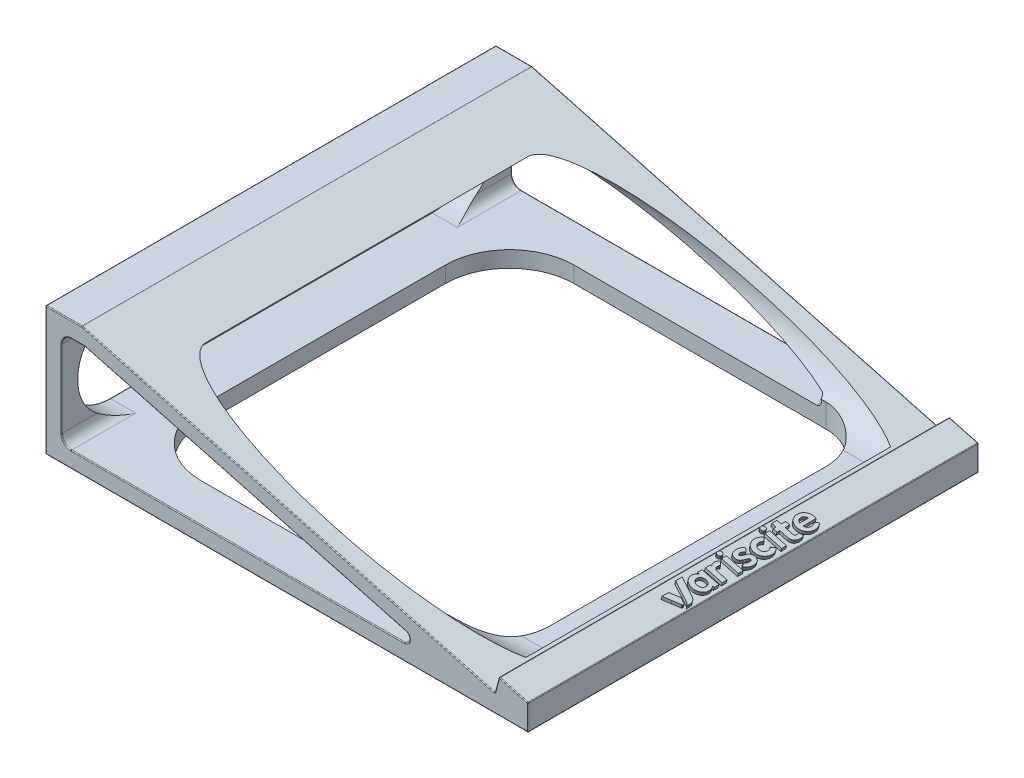
from build123d import *

# Parameters (mm, degrees)
AUFSATZ_LINEAR_AUSTRAGEN1_DEPTH = 140
SCHNITT_HINTEN_AUSTRAGEN_DEPTH  = 136
SCHNITT_BODEN_AUSTRAGEN_DEPTH   = 10
SCHNITT_SEITE_AUSTRAGEN_DEPTH   = 140
KATENVERRUNDUNG_AUSTRAGEN_R     = 0.25
LOGO_AUSTRAGEN_DEPTH            = 1


with BuildPart() as part:
    # Basis → Aufsatz-Linear austragen1 (new body)
    with BuildSketch(Plane(origin=(0, 0, 0), x_dir=(0, 1, 0), z_dir=(0, 0, 1))):
        Polygon((0, 0), (0, 150), (40, 150), (40, 138.744142368), (5.590481338, 10.326070457), (10.420110469, 9.031975232), (8, 0), align=None)
    extrude(amount=AUFSATZ_LINEAR_AUSTRAGEN1_DEPTH)

    # Schnitt Hinten → Schnitt Hinten austragen (cut)
    with BuildSketch(Plane(origin=(-150, 0, 0), x_dir=(0, -1, 0), z_dir=(-1, 0, 0))):
        with BuildLine():
            Line((-5, 120), (-5, 20))
            ThreePointArc((-5, 20), (-20, 5), (-35, 20))
            Line((-35, 20), (-35, 120))
            ThreePointArc((-35, 120), (-20, 135), (-5, 120))
        make_face()
    extrude(amount=-SCHNITT_HINTEN_AUSTRAGEN_DEPTH, mode=Mode.SUBTRACT)

    # Schnitt Boden → Schnitt Boden austragen (cut)
    with BuildSketch(Plane(origin=(0.359069892, 0, 0), x_dir=(-1, 0, 0), z_dir=(0, 1, 0))):
        with BuildLine():
            Line((35.68514035, 128), (114.10321226, 128))
            ThreePointArc((114.10321226, 128), (128.245347884, 122.142135624), (134.10321226, 108))
            Line((134.10321226, 108), (134.10321226, 32))
            ThreePointArc((134.10321226, 32), (128.245347884, 17.857864376), (114.10321226, 12))
            Line((114.10321226, 12), (35.68514035, 12))
            ThreePointArc((35.68514035, 12), (25.078538632, 16.393398282), (20.68514035, 27))
            Line((20.68514035, 27), (20.68514035, 113))
            ThreePointArc((20.68514035, 113), (25.078538632, 123.606601718), (35.68514035, 128))
        make_face()
    extrude(amount=SCHNITT_BODEN_AUSTRAGEN_DEPTH, mode=Mode.SUBTRACT)

    # Schnitt Seite → Schnitt Seite austragen (cut)
    with BuildSketch(Plane.XY.offset(140)):
        with BuildLine():
            Line((-142, 35), (-137.763461174, 35))
            Line((-137.763461174, 35), (-37.972483895, 8.261088226))
            ThreePointArc((-37.972483895, 8.261088226), (-37.170682452, 7.72534163), (-36.860712462, 6.812199487))
            Line((-36.860712462, 6.812199487), (-36.860712462, 6.5))
            ThreePointArc((-36.860712462, 6.5), (-37.300052291, 5.439339828), (-38.360712462, 5))
            Line((-38.360712462, 5), (-142, 5))
            ThreePointArc((-142, 5), (-144.121320344, 5.878679656), (-145, 8))
            Line((-145, 8), (-145, 32))
            ThreePointArc((-145, 32), (-144.121320344, 34.121320344), (-142, 35))
        make_face()
    extrude(amount=-SCHNITT_SEITE_AUSTRAGEN_DEPTH, mode=Mode.SUBTRACT)

    # Katenverrundung austragen
    katenverrundung_austragen_edges = [part.edges().sort_by_distance(p)[0] for p in [
        (-36.860712462, 6.656099743, 140),
        (0, 0, 70),
        (0, 4, 0),
        (-36.860712462, 6.656099743, 0),
        (-37.170682452, 7.72534163, 0),
        (-37.300052291, 5.439339828, 0),
        (-139.881730587, 35, 0),
        (-87.867972534, 21.630544113, 0),
        (-144.121320344, 34.121320344, 0),
        (-144.121320344, 5.878679656, 0),
        (-145, 20, 0),
        (-150, 35, 70),
        (-150, 20, 135),
        (-150, 20, 5),
        (-150, 5, 70),
        (-150, 0, 70),
        (-90.180356231, 5, 0),
        (-75, 0, 0),
        (0, 8, 70),
        (-4.515987616, 9.210055235, 0),
        (-9.679022845, 8.005295904, 0),
        (-10.326070457, 5.590481338, 70),
        (-9.031975232, 10.420110469, 70),
        (-138.744142368, 40, 70),
        (-37.300052291, 5.439339828, 140),
        (-144.121320344, 5.878679656, 140),
        (-144.121320344, 34.121320344, 140),
        (-139.881730587, 35, 140),
        (-87.867972534, 21.630544113, 140),
        (-145, 20, 140),
        (-37.170682452, 7.72534163, 140),
        (-90.180356231, 5, 140),
        (-75, 0, 140),
        (0, 4, 140),
        (-4.515987616, 9.210055235, 140),
        (-9.679022845, 8.005295904, 140),
        (-150, 20, 140),
        (-144.372071184, 40, 140),
        (-74.535106413, 22.795240669, 140),
        (-74.535106413, 22.795240669, 0),
        (-144.372071184, 40, 0),
        (-150, 20, 0),
        (-150, 40, 70),
    ]]
    fillet(katenverrundung_austragen_edges, radius=KATENVERRUNDUNG_AUSTRAGEN_R)

    # Skizze Logo → Logo austragen (add)
    # profile 1 of 12: a face of its own
    with BuildSketch(Plane(origin=(2, 7.464101615, 0), x_dir=(-0.9659258262890681, 0.25881904510252157, 0), z_dir=(0.25881904510252157, 0.9659258262890681, 0))):
        Polygon((8.765310954, 83.335963454), (8.722327205, 83.550293267), (8.6616974, 83.757364103), (8.584147923, 83.956513719), (8.49040509, 84.147079603), (8.381195148, 84.328399308), (8.257244616, 84.499810457), (8.119279742, 84.660650604), (7.968026842, 84.81025744), (7.804212233, 84.947968383), (7.628562364, 85.073121056), (7.441803485, 85.18505308), (7.244662045, 85.283102079), (7.037864227, 85.366605538), (6.82213648, 85.434901081), (6.59820512, 85.487326261), (6.366796532, 85.523218634), (6.105453465, 85.539483887), (5.809549458, 85.535778455), (5.520729813, 85.513920388), (5.280639966, 85.475727532), (5.078100426, 85.422709442), (4.883314977, 85.357432403), (4.696687144, 85.280301557), (4.518620651, 85.191722318), (4.349519091, 85.092099893), (4.189786121, 84.981839562), (4.039825334, 84.861346601), (3.900040388, 84.731026287), (3.770835009, 84.591283899), (3.652612721, 84.442524713), (3.545777182, 84.28515394), (3.450731985, 84.119576923), (3.367880854, 83.946198942), (3.297627448, 83.765425272), (3.240375225, 83.577661124), (3.196528045, 83.383311842), (3.168464425, 83.146600588), (3.159639711, 82.868815022), (3.169931355, 82.594553798), (3.199216675, 82.368415704), (3.273989911, 82.096535628), (3.382831198, 81.83759981), (3.525171772, 81.592756974), (3.700442802, 81.363155846), (3.787835009, 81.262034995), (3.523017375, 81.262034995), (3.258223616, 81.262034995), (3.258223616, 80.524447855), (3.258223616, 79.786860716), (5.970640838, 79.786860716), (8.68305806, 79.786860716), (8.68305806, 80.524447855), (8.68305806, 81.262034995), (8.418073904, 81.262034995), (8.153089816, 81.262034995), (8.25846962, 81.375052413), (8.411710126, 81.563509964), (8.540459104, 81.772754622), (8.644121622, 82.00048651), (8.722102613, 82.244405888), (8.773807008, 82.502213012), (8.798639874, 82.77160821), (8.796006212, 83.050291605), align=None)
        Polygon((7.409697141, 82.224705185), (7.364920837, 82.082588192), (7.305111097, 81.947105836), (7.231230092, 81.819432336), (7.144240127, 81.70074171), (7.045103375, 81.592208174), (6.934782073, 81.495005813), (6.814238528, 81.410308846), (6.684434844, 81.339291288), (6.503942015, 81.261565442), (6.342001097, 81.213303713), (6.172828585, 81.188842469), (5.970640838, 81.182518348), (5.801570438, 81.188760995), (5.645878304, 81.206620447), (5.501868465, 81.236747616), (5.367844743, 81.279793616), (5.242111098, 81.336409496), (5.122971422, 81.407246368), (5.008729539, 81.492955214), (4.897689476, 81.594187147), (4.801529006, 81.698470767), (4.719056579, 81.807107426), (4.64999014, 81.920796394), (4.59404743, 82.04023701), (4.550946394, 82.166128544), (4.520404708, 82.299170265), (4.502140316, 82.440061445), (4.495871028, 82.589501489), (4.504615617, 82.769270699), (4.531436224, 82.940729802), (4.575901404, 83.102976449), (4.637579979, 83.255108494), (4.716040504, 83.396223525), (4.8108516, 83.525419259), (4.921582023, 83.641793552), (5.047800328, 83.74444399), (5.146700955, 83.80874692), (5.251467752, 83.864777376), (5.477340787, 83.951649447), (5.72290117, 84.004317429), (5.985630503, 84.022038484), (6.238349235, 84.004307717), (6.474034785, 83.952218616), (6.690371493, 83.867426079), (6.885043702, 83.751584938), (7.055735751, 83.606349892), (7.200132051, 83.433375906), (7.315916942, 83.234317745), (7.400774699, 83.010830309), (7.431903966, 82.83742481), (7.444075237, 82.621524066), (7.436826916, 82.40374518), align=None, mode=Mode.SUBTRACT)
    # profile 2 of 12: a face of its own
    with BuildSketch(Plane(origin=(2, 7.464101615, 0), x_dir=(-0.9659258262890681, 0.25881904510252157, 0), z_dir=(0.25881904510252157, 0.9659258262890681, 0))):
        Polygon((8.765096816, 50.64212803), (8.720637706, 50.845958199), (8.662313376, 51.044818408), (8.590749244, 51.238006893), (8.506570659, 51.424822089), (8.410402973, 51.604562231), (8.302871536, 51.776525552), (8.184601767, 51.940010423), (8.056219015, 52.094315144), (7.918348699, 52.238738017), (7.771616103, 52.372577277), (7.616646711, 52.495131291), (7.454065739, 52.605698363), (7.28449874, 52.703576725), (7.10857093, 52.788064815), (6.926907727, 52.858460732), (6.74013455, 52.914062979), (6.435428018, 52.974977604), (6.128353963, 53.004662401), (5.822337851, 53.003646746), (5.520804879, 52.972460217), (5.227180583, 52.911632259), (4.944890227, 52.82169245), (4.677359278, 52.703170166), (4.428013001, 52.556594919), (4.193494993, 52.380639592), (3.980692473, 52.182419233), (3.79022162, 51.962920566), (3.622698746, 51.723130377), (3.478739962, 51.464035389), (3.358961514, 51.186622322), (3.26397958, 50.891878101), (3.194410405, 50.580789311), (3.164941904, 50.312773432), (3.155776323, 49.990216958), (3.166766495, 49.665532526), (3.197765257, 49.391132634), (3.244017326, 49.170586343), (3.30313798, 48.959049699), (3.374842061, 48.757114197), (3.458844344, 48.565371128), (3.554859537, 48.384411917), (3.662602414, 48.214827989), (3.78178775, 48.057210704), (3.91213032, 47.912151487), (4.079086723, 47.741768807), (4.504008284, 48.179157993), (4.928929893, 48.616547158), (4.797425244, 48.761851808), (4.703805161, 48.874889325), (4.622934958, 48.993440812), (4.554417252, 49.118579322), (4.497854789, 49.251377701), (4.452850252, 49.392908935), (4.419006185, 49.544245938), (4.395925407, 49.70646156), (4.383210529, 49.880628784), (4.38075971, 50.053981474), (4.38902834, 50.214742711), (4.408455013, 50.364532188), (4.439478324, 50.50496953), (4.482536869, 50.637674431), (4.538069311, 50.764266718), (4.60651411, 50.886365951), (4.688309928, 51.005591889), (4.834121697, 51.166226059), (5.010760378, 51.305093955), (5.206698328, 51.414508862), (5.410407702, 51.486784271), (5.47072328, 51.501916649), (5.47679057, 49.460180324), (5.482881601, 47.418420124), (5.578054135, 47.395126691), (5.781559758, 47.378525022), (6.137192773, 47.371309749), (6.565266909, 47.380535492), (6.69382495, 47.399328383), (6.832095013, 47.43355257), (7.017704089, 47.491123741), (7.196872027, 47.56095204), (7.369130623, 47.642527718), (7.534011808, 47.735340956), (7.69104738, 47.838882006), (7.839769201, 47.952641117), (7.979709069, 48.07610854), (8.110398981, 48.208774525), (8.231370667, 48.350129188), (8.342155991, 48.499662913), (8.442286816, 48.656865883), (8.531295074, 48.821228349), (8.608712494, 48.992240492), (8.674070939, 49.169392632), (8.726902341, 49.352174951), (8.766738496, 49.540077631), (8.791372197, 49.784069512), (8.799242901, 50.093065752), (8.790450965, 50.401080531), align=None)
        Polygon((7.560521831, 49.724236504), (7.527889618, 49.6061717), (7.480643072, 49.48989419), (7.42031731, 49.377452213), (7.348447651, 49.270894009), (7.26656928, 49.172267883), (7.176217382, 49.083622007), (7.07892714, 49.007004688), (6.976233807, 48.944464165), (6.842012337, 48.881415309), (6.710904737, 48.831179058), (6.607313846, 48.802008732), (6.555642633, 48.802157381), (6.545777377, 49.206509807), (6.541676043, 50.159056022), (6.541676043, 51.501988073), (6.607107194, 51.486760462), (6.847298815, 51.386591396), (6.959420023, 51.323065028), (7.067743333, 51.244213255), (7.170393636, 51.152258929), (7.265495892, 51.049424838), (7.351174927, 50.937933702), (7.425555632, 50.820008442), (7.486762969, 50.697871777), (7.532921761, 50.573746563), (7.574875759, 50.379894216), (7.593903562, 50.160091034), (7.589340499, 49.934738068), align=None, mode=Mode.SUBTRACT)
    # profile 3 of 12: a face of its own
    with BuildSketch(Plane(origin=(2, 7.464101615, 0), x_dir=(-0.9659258262890681, 0.25881904510252157, 0), z_dir=(0.25881904510252157, 0.9659258262890681, 0))):
        Polygon((8.799668209, 69.533090856), (8.749794071, 69.792686556), (8.669757692, 70.053161201), (8.565488033, 70.298253515), (8.442913988, 70.511702429), (8.320901085, 70.672384687), (8.186306508, 70.811589268), (8.039097817, 70.929332562), (7.879242704, 71.025631159), (7.706708865, 71.100501381), (7.521463925, 71.153959819), (7.323475443, 71.186022729), (7.112711248, 71.196706768), (6.851085856, 71.18158916), (6.617687638, 71.134685505), (6.510637287, 71.098586818), (6.409519875, 71.053669149), (6.313960881, 70.999641677), (6.223585646, 70.936213577), (6.138019582, 70.863094094), (6.056888165, 70.779992337), (5.906430578, 70.582678845), (5.769216165, 70.341946584), (5.642248006, 70.055469103), (5.552301048, 69.786160572), (5.435319142, 69.389261364), (5.298738713, 68.941351569), (5.237440798, 68.779979213), (5.17740451, 68.654145749), (5.116080089, 68.559213994), (5.050917639, 68.490546762), (4.979367265, 68.443506935), (4.898879139, 68.413457395), (4.822031361, 68.400866953), (4.748660847, 68.404840142), (4.67967062, 68.424742707), (4.615963904, 68.459940261), (4.558443789, 68.509798415), (4.508013364, 68.573682915), (4.465575718, 68.650959442), (4.432034076, 68.740993675), (4.400719334, 68.916093259), (4.39337025, 69.18701973), (4.401582294, 69.380558456), (4.423479681, 69.564484441), (4.459317289, 69.739521369), (4.509349855, 69.906393195), (4.573832324, 70.065823741), (4.653019502, 70.218536826), (4.747166197, 70.365256271), (4.856527351, 70.506705896), (5.001594122, 70.679039559), (4.564133522, 71.11830836), (4.12667299, 71.557553422), (3.948224488, 71.367731794), (3.824588857, 71.225179308), (3.710341848, 71.071096953), (3.605733885, 70.906562098), (3.511015256, 70.732652177), (3.426436453, 70.550444692), (3.352247763, 70.361017079), (3.288699678, 70.16544684), (3.236042487, 69.964811342), (3.194526613, 69.760188087), (3.164402479, 69.55265451), (3.145920374, 69.343288046), (3.139330789, 69.133166198), (3.14488408, 68.923366399), (3.162830604, 68.714966086), (3.193420783, 68.50904276), (3.236904974, 68.306673789), (3.305610583, 68.099756795), (3.404027966, 67.869570109), (3.472677798, 67.735540452), (3.537227847, 67.632293125), (3.6136893, 67.537307953), (3.71807348, 67.428064761), (3.832174943, 67.321463594), (3.946325101, 67.231111493), (4.062975312, 67.155941545), (4.18457653, 67.0948865), (4.313580114, 67.046879443), (4.452437016, 67.010853259), (4.603598595, 66.9857409), (4.769515871, 66.970475183), (5.016357171, 66.970364236), (5.245680426, 67.001601078), (5.457807888, 67.064376445), (5.653062012, 67.158881138), (5.831764984, 67.285305758), (5.99423919, 67.443841105), (6.140806884, 67.63467778), (6.271790519, 67.858006653), (6.355220801, 68.047287371), (6.450908211, 68.311697097), (6.554416145, 68.638068668), (6.661307933, 69.013234649), (6.7369359, 69.25498931), (6.820085475, 69.454745999), (6.906348922, 69.603439696), (6.949271026, 69.655805053), (6.991318704, 69.692005177), (7.086514642, 69.735408704), (7.189345967, 69.748326524), (7.288746632, 69.731001776), (7.373650521, 69.683677601), (7.432166597, 69.622381169), (7.481540496, 69.545442812), (7.521434316, 69.454345173), (7.55151016, 69.350570764), (7.571430058, 69.235602025), (7.580856045, 69.110921468), (7.579450153, 68.978011669), (7.566874549, 68.838355138), (7.514904083, 68.577168274), (7.476006763, 68.455632477), (7.428223085, 68.339532078), (7.371344035, 68.228414925), (7.305160871, 68.121828663), (7.14404683, 67.920439871), (7.020750784, 67.787745559), (7.450978239, 67.340268086), (7.881205693, 66.892814422), (7.945899197, 66.938877914), (8.045531468, 67.026343704), (8.167889151, 67.156846793), (8.291049833, 67.305462456), (8.393091175, 67.44726583), (8.535574463, 67.704781862), (8.654027481, 67.995846214), (8.74401349, 68.307619571), (8.801095819, 68.627262486), (8.81702007, 68.835134164), (8.822045671, 69.082585707), (8.816239393, 69.328832749), align=None)
    # profile 4 of 12: a face of its own
    with BuildSketch(Plane(origin=(2, 7.464101615, 0), x_dir=(-0.9659258262890681, 0.25881904510252157, 0), z_dir=(0.25881904510252157, 0.9659258262890681, 0))):
        Polygon((9.361162366, 56.826486862), (8.68305806, 56.826486862), (8.68305806, 57.266659832), (8.68305806, 57.706832802), (8.052540022, 57.706832802), (7.422021983, 57.706832802), (7.422021983, 57.266659832), (7.422021983, 56.826486862), (6.238313624, 56.826463054), (5.327619497, 56.819369722), (4.800304204, 56.802336809), (4.572265575, 56.770461127), (4.351351573, 56.719694353), (4.145088122, 56.652122226), (3.961001416, 56.56983035), (3.799116612, 56.463379113), (3.628599447, 56.315398446), (3.472839936, 56.148466593), (3.355228228, 55.985161666), (3.286422396, 55.85618189), (3.226692106, 55.718211621), (3.176067709, 55.571381431), (3.134579622, 55.415821693), (3.102258195, 55.251663046), (3.079133847, 55.079035862), (3.060597854, 54.708897978), (3.068856636, 54.437209783), (3.094940271, 54.196801325), (3.14080932, 53.975063077), (3.208424611, 53.759385374), (3.323535794, 53.504450869), (3.37843695, 53.412504907), (3.414235169, 53.3764825), (3.919529987, 53.565614097), (4.478716174, 53.779585777), (4.545265564, 53.804425793), (4.486544118, 53.905713166), (4.422285971, 54.038540952), (4.379947941, 54.179432334), (4.358519634, 54.333069416), (4.35699052, 54.504134302), (4.377690555, 54.705189241), (4.400480646, 54.776374198), (4.4370068, 54.851656779), (4.512137023, 54.959899896), (4.609289946, 55.049223055), (4.724336786, 55.116579223), (4.853148758, 55.158921299), (5.258018623, 55.178104495), (6.197841462, 55.184760648), (7.422021983, 55.184760648), (7.422021983, 54.482863209), (7.422021983, 53.78096577), (8.052540022, 53.78096577), (8.68305806, 53.78096577), (8.68305806, 54.482863209), (8.68305806, 55.184760648), (9.361162366, 55.184760648), (10.039266671, 55.184760648), (10.039266671, 56.005623755), (10.039266671, 56.826486862), align=None)
    # profile 5 of 12: a face of its own
    with BuildSketch(Plane(origin=(2, 7.464101615, 0), x_dir=(-0.9659258262890681, 0.25881904510252157, 0), z_dir=(0.25881904510252157, 0.9659258262890681, 0))):
        Polygon((8.801095819, 63.67869518), (8.770971415, 63.900628547), (8.726824104, 64.116606717), (8.669080341, 64.326071111), (8.598166379, 64.528462879), (8.51450874, 64.723223305), (8.418533745, 64.909793676), (8.310667781, 65.087615275), (8.191337235, 65.256129389), (8.060968631, 65.414777235), (7.919988221, 65.56300003), (7.768822393, 65.700239195), (7.60789767, 65.82593588), (7.437640304, 65.939531369), (7.258476817, 66.040467017), (7.07083353, 66.128183971), (6.875136832, 66.202123519), (6.617812479, 66.274103518), (6.353238119, 66.320831546), (6.084462471, 66.342484851), (5.81453412, 66.339240406), (5.546501717, 66.311275256), (5.283414116, 66.258766444), (5.028319834, 66.18189108), (4.78426759, 66.080826141), (4.503711583, 65.927655846), (4.246402608, 65.746894383), (4.013295213, 65.539738634), (3.805343747, 65.307385747), (3.623502624, 65.051032603), (3.468726327, 64.771876283), (3.341969203, 64.471113737), (3.244185669, 64.149941978), (3.192679832, 63.85054108), (3.166515937, 63.49446495), (3.167534223, 63.134230968), (3.197574927, 62.822356511), (3.241451985, 62.606867789), (3.299892456, 62.398082904), (3.372882579, 62.196029441), (3.460408732, 62.000734984), (3.56245729, 61.812227187), (3.679014495, 61.630533567), (3.810066722, 61.455681775), (3.955600348, 61.287699398), (4.066048109, 61.168733731), (4.538103843, 61.655446086), (5.010135836, 62.142158441), (4.913392979, 62.244564053), (4.817120348, 62.361099473), (4.726613866, 62.497815197), (4.649129676, 62.642556613), (4.591923922, 62.783169245), (4.558062455, 62.907270921), (4.533787292, 63.043817425), (4.514028182, 63.336731323), (4.532711341, 63.626883749), (4.556489029, 63.759978415), (4.589901514, 63.879247518), (4.650913867, 64.026497419), (4.728825929, 64.164928675), (4.82235105, 64.293295442), (4.930202783, 64.410351875), (5.051094682, 64.514852263), (5.183740231, 64.605550762), (5.326852849, 64.681201593), (5.479146089, 64.740558912), (5.589265527, 64.77289086), (5.690027571, 64.79233871), (5.958744271, 64.805466621), (6.129690252, 64.801673376), (6.282955105, 64.787081233), (6.421698092, 64.760485015), (6.549078678, 64.72067975), (6.66825619, 64.666460328), (6.782390026, 64.596621643), (6.894639582, 64.509958585), (7.008164187, 64.405266113), (7.120671114, 64.283362875), (7.21546899, 64.157521589), (7.293016984, 64.026507468), (7.353774327, 63.889085932), (7.398200388, 63.744022398), (7.426754199, 63.590082082), (7.439895127, 63.426030471), (7.438082338, 63.250632914), (7.424775361, 63.101701541), (7.400337857, 62.956973951), (7.365243157, 62.8176651), (7.31996432, 62.684989807), (7.264974542, 62.560162894), (7.200746948, 62.444399248), (7.127754801, 62.338913622), (7.046471161, 62.244920972), (6.959412065, 62.155244604), (7.434584773, 61.678739519), (7.909781221, 61.202234434), (8.071574502, 61.370975366), (8.260884626, 61.595796663), (8.42474793, 61.846983785), (8.561870685, 62.120445718), (8.670959226, 62.412091513), (8.750719754, 62.717830291), (8.799858539, 63.033571104), (8.817081782, 63.355223072), align=None)
    # profile 6 of 12: a face of its own
    with BuildSketch(Plane(origin=(2, 7.464101615, 0), x_dir=(-0.9659258262890681, 0.25881904510252157, 0), z_dir=(0.25881904510252157, 0.9659258262890681, 0))):
        Polygon((9.212455315, 87.293237425), (5.408989063, 88.831311844), (3.905364501, 89.449679385), (3.224389802, 89.739909171), (3.091562016, 89.823666966), (2.959307513, 89.930105523), (2.841734856, 90.046635345), (2.752952606, 90.160666934), (2.684214287, 90.267736035), (2.693041496, 89.577735163), (2.703091147, 89.122245015), (2.728415958, 88.835921781), (2.751387678, 88.728158333), (2.783675517, 88.629039386), (2.883529346, 88.41187162), (2.95330153, 88.285379084), (3.033104482, 88.162330359), (3.217903205, 87.931907615), (3.428126289, 87.73129026), (3.539709825, 87.645498187), (3.653974774, 87.57116503), (4.601606267, 87.1596929), (6.578519728, 86.322551928), (8.570547762, 85.48712858), (9.563522974, 85.080809118), (9.579040599, 85.078374823), (9.590744138, 85.089953522), (9.604860591, 85.201306463), (9.610990268, 86.099892853), (9.610990268, 87.134037609), align=None)
    # profile 7 of 12: a face of its own
    with BuildSketch(Plane(origin=(2, 7.464101615, 0), x_dir=(-0.9659258262890681, 0.25881904510252157, 0), z_dir=(0.25881904510252157, 0.9659258262890681, 0))):
        Polygon((8.764739896, 76.245633471), (8.701672492, 76.49922737), (8.607657653, 76.73037697), (8.481200862, 76.942084519), (8.320807606, 77.137352537), (8.200295356, 77.264788562), (8.441676708, 77.264788562), (8.68305806, 77.264788562), (8.68305806, 78.014272268), (8.68305806, 78.763755974), (5.970640838, 78.763755974), (3.258223616, 78.763755974), (3.258223616, 78.014272268), (3.258223616, 77.264788562), (4.834518746, 77.264598232), (6.022316569, 77.257867755), (6.56040122, 77.240162685), (6.780410042, 77.188005126), (6.967260849, 77.107010353), (7.049807196, 77.054826221), (7.12593021, 76.994385533), (7.261394558, 76.847338035), (7.358683181, 76.701388745), (7.41822105, 76.55719269), (7.448216768, 76.385836779), (7.45687894, 76.158407853), (7.455711196, 75.984219451), (7.447679905, 75.873797387), (7.427759467, 75.792663137), (7.390924348, 75.706338316), (7.326736411, 75.587699824), (7.266153144, 75.502930826), (7.208145536, 75.442282137), (7.736876501, 74.970250143), (8.265583725, 74.498194342), (8.373200075, 74.618563811), (8.498768479, 74.779120622), (8.60330313, 74.955487634), (8.686374267, 75.14587789), (8.747552332, 75.348504434), (8.786407566, 75.561580308), (8.802510344, 75.783318422), (8.795431041, 76.011931817), align=None)
    # profile 8 of 12: a face of its own
    with BuildSketch(Plane(origin=(2, 7.464101615, 0), x_dir=(-0.9659258262890681, 0.25881904510252157, 0), z_dir=(0.25881904510252157, 0.9659258262890681, 0))):
        Polygon((5.970640838, 60.276491223), (3.258223616, 60.276491223), (3.258223616, 59.527007517), (3.258223616, 58.777523811), (5.970640838, 58.777523811), (8.68305806, 58.777523811), (8.68305806, 59.527007517), (8.68305806, 60.276491223), align=None)
    # profile 9 of 12: a face of its own
    with BuildSketch(Plane(origin=(2, 7.464101615, 0), x_dir=(-0.9659258262890681, 0.25881904510252157, 0), z_dir=(0.25881904510252157, 0.9659258262890681, 0))):
        Polygon((5.970640838, 73.7434048), (3.258223616, 73.7434048), (3.258223616, 72.993921094), (3.258223616, 72.244437388), (5.970640838, 72.244437388), (8.68305806, 72.244437388), (8.68305806, 72.993921094), (8.68305806, 73.7434048), align=None)
    # profile 10 of 12: a face of its own
    with BuildSketch(Plane(origin=(2, 7.464101615, 0), x_dir=(-0.9659258262890681, 0.25881904510252157, 0), z_dir=(0.25881904510252157, 0.9659258262890681, 0))):
        Polygon((7.907687456, 92.992049824), (5.703774088, 92.011183833), (3.477286993, 91.002943848), (3.417962386, 90.951235608), (3.373733736, 90.886300988), (3.344865497, 90.812131655), (3.331622457, 90.732719278), (3.334269136, 90.652055525), (3.353070121, 90.574132133), (3.388290066, 90.502940634), (3.440193492, 90.442472833), (3.719468042, 90.304854829), (4.287809019, 90.046543148), (4.856091993, 89.796779183), (5.135192535, 89.684804264), (6.349635743, 90.217809087), (7.834999419, 90.889521962), (7.921677788, 90.930850676), (7.921677788, 91.96145025), (7.917564583, 92.689308979), align=None)
    # profile 11 of 12: a face of its own
    with BuildSketch(Plane(origin=(2, 7.464101615, 0), x_dir=(-0.9659258262890681, 0.25881904510252157, 0), z_dir=(0.25881904510252157, 0.9659258262890681, 0))):
        Polygon((10.752751374, 73.140391599), (10.700016891, 73.300691916), (10.612235054, 73.443878994), (10.491984558, 73.5666605), (10.341843962, 73.665744039), (10.270234439, 73.69958453), (10.203900266, 73.719332107), (10.015473538, 73.730842011), (9.827216299, 73.719358882), (9.761030505, 73.699715037), (9.689816952, 73.66610089), (9.593733707, 73.608296225), (9.509785785, 73.542211531), (9.438181522, 73.468183698), (9.379129123, 73.386549411), (9.332836992, 73.297645625), (9.299513264, 73.201809162), (9.279366278, 73.099376707), (9.272604304, 72.990685215), (9.275342371, 72.893507741), (9.286157456, 72.817527711), (9.308950919, 72.745594047), (9.347624052, 72.66055547), (9.422211476, 72.53641852), (9.513262915, 72.433967517), (9.621289331, 72.352725154), (9.746801486, 72.292213985), (9.844108994, 72.263492506), (9.944532463, 72.248318244), (10.046242379, 72.246375489), (10.14740943, 72.257348126), (10.246204236, 72.280920377), (10.340797417, 72.316776329), (10.429359594, 72.364600003), (10.510061385, 72.424075553), (10.574965655, 72.489973154), (10.631957339, 72.568421808), (10.680054502, 72.656523402), (10.718275146, 72.751379821), (10.745637134, 72.850093019), (10.761158536, 72.949764745), (10.763857283, 73.047497022), align=None)
    # profile 12 of 12: a face of its own
    with BuildSketch(Plane(origin=(2, 7.464101615, 0), x_dir=(-0.9659258262890681, 0.25881904510252157, 0), z_dir=(0.25881904510252157, 0.9659258262890681, 0))):
        Polygon((10.752751374, 59.673478022), (10.699903111, 59.834022963), (10.611985237, 59.977316334), (10.491723613, 60.099874058), (10.341843962, 60.198211788), (10.27032812, 60.23161065), (10.203793231, 60.251175315), (10.015473538, 60.262667414), (9.828352411, 60.251389453), (9.762924295, 60.232514076), (9.694266235, 60.200567307), (9.538567695, 60.098560565), (9.473912162, 60.038842415), (9.417992248, 59.973232872), (9.370762833, 59.901670965), (9.332178593, 59.824095657), (9.280765358, 59.650660414), (9.268516728, 59.532259194), (9.275132347, 59.415879438), (9.299753436, 59.30329731), (9.34152115, 59.19628891), (9.399576779, 59.096630335), (9.473061477, 59.006097751), (9.561116534, 58.926467257), (9.662883104, 58.85951495), (9.737635905, 58.821651495), (9.805219565, 58.800546655), (9.889782586, 58.791402251), (10.015473538, 58.789420378), (10.14116449, 58.791402251), (10.225727511, 58.800546655), (10.293311171, 58.821651495), (10.368063971, 58.85951495), (10.478966784, 58.93355027), (10.567902539, 59.013099628), (10.62122022, 59.08236213), (10.666968946, 59.159221779), (10.7336336, 59.328129637), (10.763644898, 59.504617039), (10.763576981, 59.590951235), align=None)
    extrude(amount=LOGO_AUSTRAGEN_DEPTH)


solid = part.part
